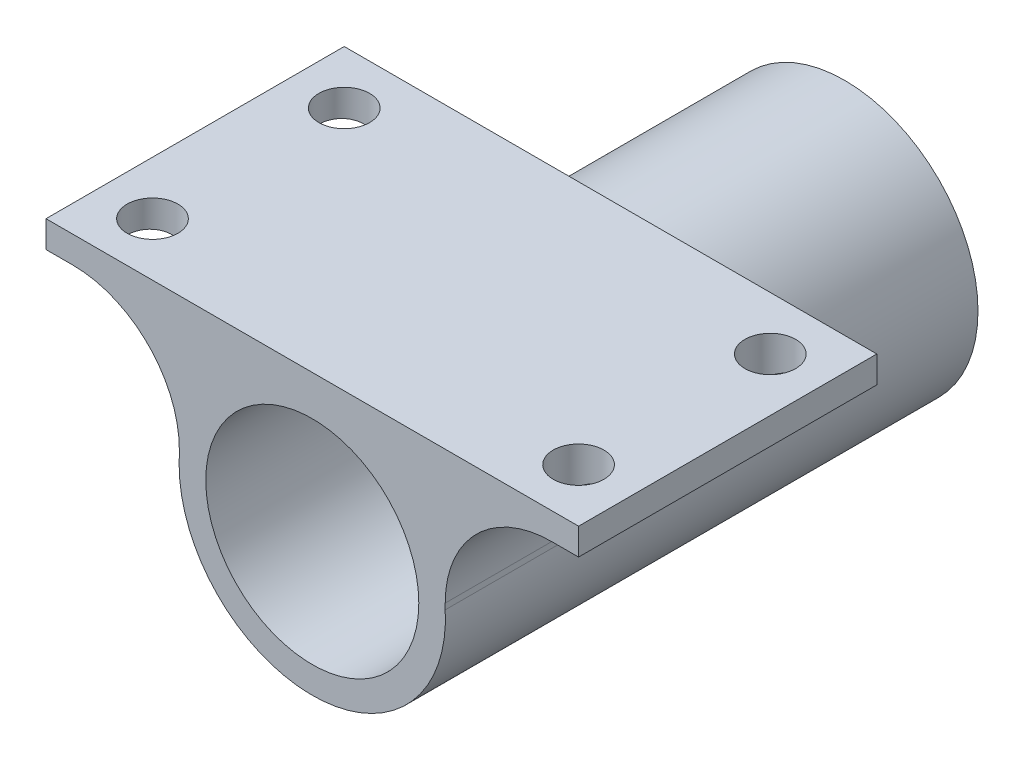
from build123d import *

# Parameters (mm, degrees)
SKETCH1_R           = 10
BOSS_EXTRUDE1_DEPTH = 48
BOSS_EXTRUDE3_START = 2
SKETCH3_R           = 12.5
SKETCH3_R_2         = 3.5
SKETCH3_R_3         = 0.95
BOSS_EXTRUDE3_DEPTH = 2
SKETCH4_R           = 2.38125
CUT_EXTRUDE1_DEPTH  = 61.153219082
SKETCH6_W           = 58.309477214
SKETCH6_H           = 41.572471276
SKETCH6_R           = 12.5
CUT_EXTRUDE4_DEPTH  = 22


with BuildPart() as part:
    # Sketch1 → Boss-Extrude1 (new body)
    with BuildSketch(Plane.XY):
        with BuildLine():
            Line((-25, 11.243386243), (-25, 13.756613757))
            Line((-25, 13.756613757), (25, 13.756613757))
            Line((25, 13.756613757), (25, 11.243386243))
            Line((25, 11.243386243), (22.480898871, 11.243386243))
            ThreePointArc((22.480898871, 11.243386243), (15.409831059, 8.314454055), (12.480898871, 1.243386243))
            Line((12.480898871, 1.243386243), (12.480898871, 0.690770135))
            ThreePointArc((12.480898871, 0.690770135), (0, -12.5), (-12.480898871, 0.690770135))
            Line((-12.480898871, 0.690770135), (-12.480898871, 1.243386243))
            ThreePointArc((-12.480898871, 1.243386243), (-15.409831059, 8.314454055), (-22.480898871, 11.243386243))
            Line((-22.480898871, 11.243386243), (-25, 11.243386243))
        make_face()
        Circle(SKETCH1_R, mode=Mode.SUBTRACT)
    extrude(amount=BOSS_EXTRUDE1_DEPTH)

    # Sketch3 → Boss-Extrude3 (add)
    with BuildSketch(Plane(origin=(0, 0, 0), x_dir=(-1, 0, 0), z_dir=(0, 0, -1)).offset(BOSS_EXTRUDE3_START)):
        Circle(SKETCH3_R)
        Circle(SKETCH3_R_2, mode=Mode.SUBTRACT)
        with Locations((7.5, 0)):
            Circle(SKETCH3_R_3, mode=Mode.SUBTRACT)
        with Locations((-7.5, 0)):
            Circle(SKETCH3_R_3, mode=Mode.SUBTRACT)
    extrude(amount=-BOSS_EXTRUDE3_DEPTH)

    # Sketch4 → Cut-Extrude1 (cut, through all)
    with BuildSketch(Plane(origin=(0, 13.756613757, 0), x_dir=(1, 0, 0), z_dir=(0, 1, 0))):
        with Locations((-20, -25)):
            Circle(SKETCH4_R)
        with Locations((20, -25)):
            Circle(SKETCH4_R)
        with Locations((20, -43)):
            Circle(SKETCH4_R)
        with Locations((-20, -43)):
            Circle(SKETCH4_R)
    extrude(amount=-CUT_EXTRUDE1_DEPTH, mode=Mode.SUBTRACT)

    # Sketch6 → Cut-Extrude4 (cut)
    with BuildSketch(Plane(origin=(0, 0, -2), x_dir=(-1, 0, 0), z_dir=(0, 0, -1))):
        Rectangle(SKETCH6_W, SKETCH6_H)
        Circle(SKETCH6_R, mode=Mode.SUBTRACT)
    extrude(amount=-CUT_EXTRUDE4_DEPTH, mode=Mode.SUBTRACT)


solid = part.part
